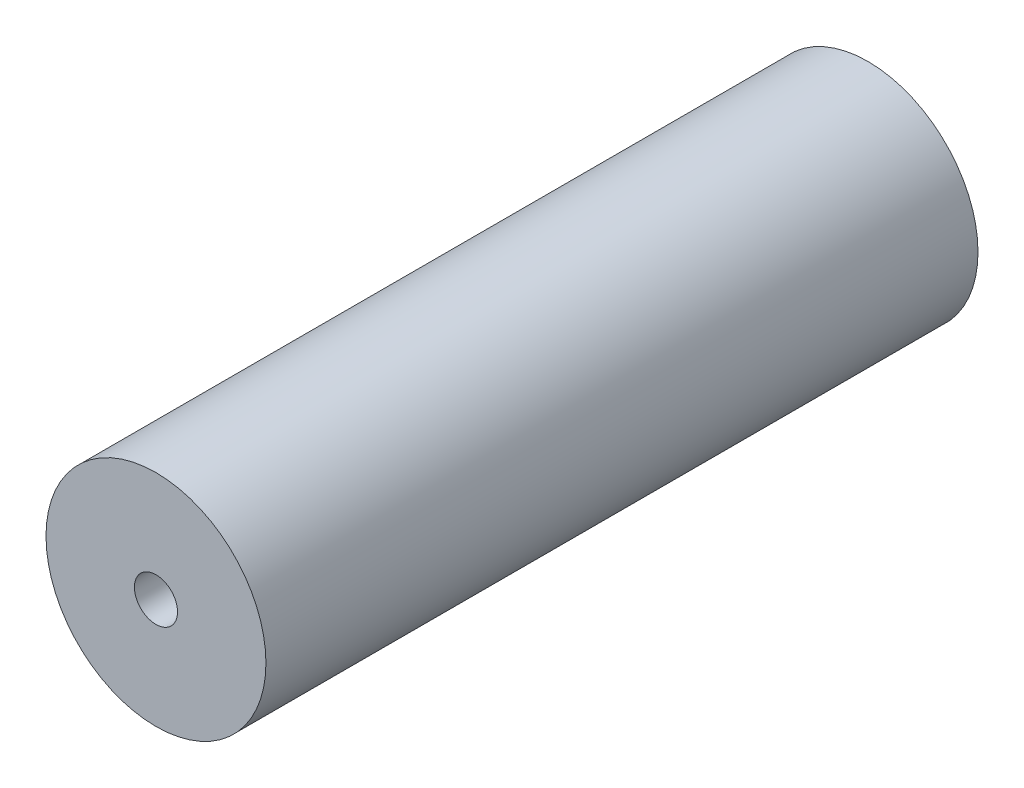
from build123d import *

# Parameters (mm, degrees)
SKETCH1_R           = 12.7
SKETCH1_R_2         = 2.4892
BOSS_EXTRUDE1_DEPTH = 82.2325


with BuildPart() as part:
    # Sketch1 → Boss-Extrude1 (new body)
    with BuildSketch(Plane.XY):
        Circle(SKETCH1_R)
        Circle(SKETCH1_R_2, mode=Mode.SUBTRACT)
    extrude(amount=BOSS_EXTRUDE1_DEPTH)


solid = part.part
